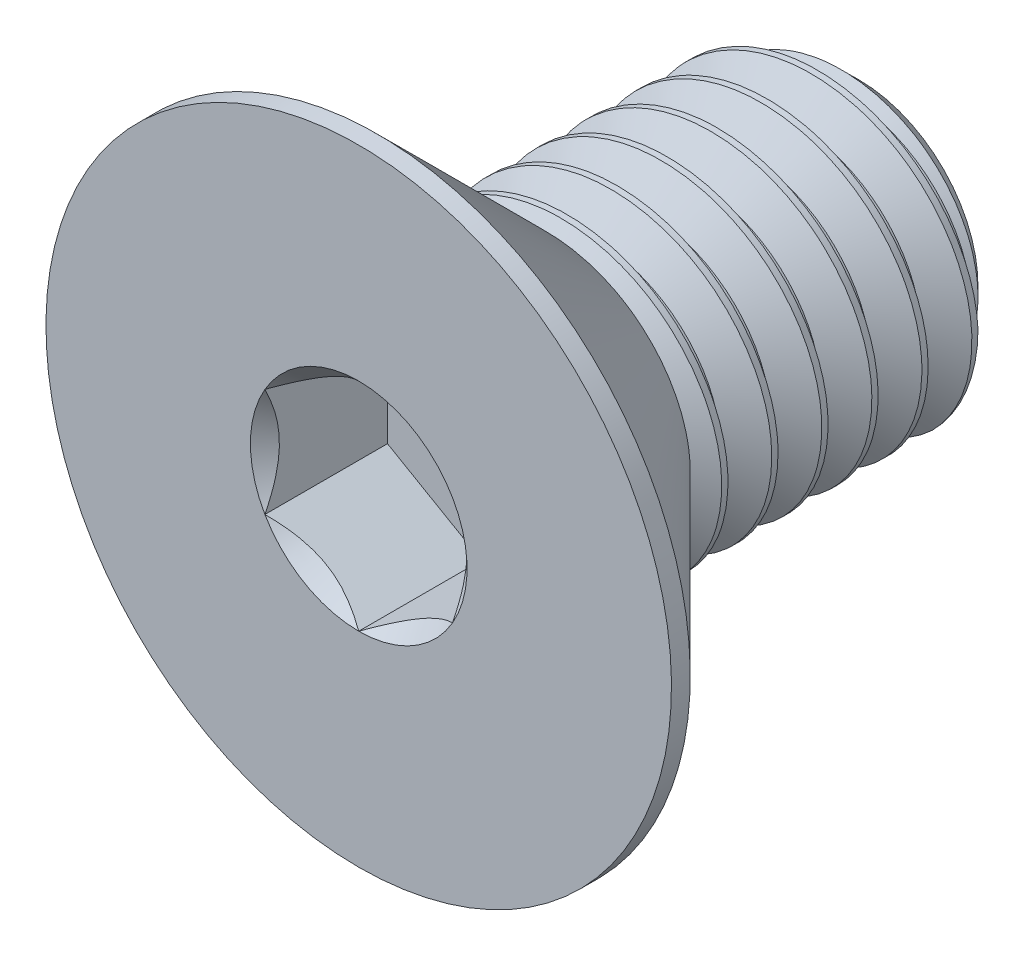
from build123d import *
from build123d.topology import SkipClean

# Parameters (mm, degrees)
SKETCH1_W          = 8
SKETCH1_H          = 2.5
CHAMFER1_SIZE      = 0.6
CUT_SWEEP1_PITCH   = 0.8
CUT_EXTRUDE2_DEPTH = 1.96


with BuildPart() as part:
    # Sketch1 → Revolve1 (revolve)
    with BuildSketch(Plane(origin=(0, 0, 0), x_dir=(0, 0, -1), z_dir=(1, 0, 0))):
        with Locations((4, 1.25)):
            Rectangle(SKETCH1_W, SKETCH1_H)
    revolve(axis=Axis((0, 0, -8), (0, 0, 1)))

    # Chamfer1
    chamfer1_edges = [part.edges().sort_by_distance(p)[0] for p in [
        (0, -2.5, -8),
    ]]
    chamfer(chamfer1_edges, length=CHAMFER1_SIZE)

    # Cut-Sweep1: the profile of Sketch2 profile screwed along a right-hand helix of 10 turns, 8 arcs to a turn; built about Z, then put on its axis
    cut_sweep1_z = Axis((0, 0, 0), (0, 0, 1))
    cut_sweep1_corners = [(2.5006, 0, 0.00034641), (2.5006, 0, -0.70034641), (1.980384758, 0, -0.4), (1.980384758, 0, -0.3)]
    with BuildLine(mode=Mode.PRIVATE) as cut_sweep1_profile:
        Line(cut_sweep1_corners[0], cut_sweep1_corners[1])
        Line(cut_sweep1_corners[1], cut_sweep1_corners[2])
        Line(cut_sweep1_corners[2], cut_sweep1_corners[3])
        Line(cut_sweep1_corners[3], cut_sweep1_corners[0])
    cut_sweep1_cap = Face(cut_sweep1_profile.wire())
    cut_sweep1_turn_angles = [0, 22.5, 45, 67.5, 90, 112.5, 135, 157.5, 180, 202.5, 225, 247.5, 270, 292.5, 315, 337.5, 360]
    cut_sweep1_turn_weights = [1, 0.9238795325112867, 1, 0.9238795325112867, 1, 0.9238795325112867, 1, 0.9238795325112867, 1, 0.9238795325112867, 1, 0.9238795325112867, 1, 0.9238795325112867, 1, 0.9238795325112867, 1]
    cut_sweep1_turn_rails = [Edge.make_bspline([Vector(p[0], p[1], 0).rotate(cut_sweep1_z, cut_sweep1_turn_angles[k]) / cut_sweep1_turn_weights[k] + Vector(0, 0, p[2] + CUT_SWEEP1_PITCH * cut_sweep1_turn_angles[k] / 360) for k in range(17)], [0, 0, 0, 1, 1, 2, 2, 3, 3, 4, 4, 5, 5, 6, 6, 7, 7, 8, 8, 8], 2, cut_sweep1_turn_weights) for p in cut_sweep1_corners]
    cut_sweep1_turn_sides = [Face.make_surface_from_curves(cut_sweep1_turn_rails[p[0]], cut_sweep1_turn_rails[p[1]]) for p in [(0, 1), (1, 2), (2, 3), (3, 0)]]
    cut_sweep1 = Plane(origin=(0, 0, -8), x_dir=(0, 1, 0), z_dir=(0, 0, 1)) * Solid(Shell([*[p.moved(Location((0, 0, CUT_SWEEP1_PITCH * i))) for i in range(10) for p in cut_sweep1_turn_sides], cut_sweep1_cap, cut_sweep1_cap.rotate(cut_sweep1_z, 3600).moved(Location((0, 0, CUT_SWEEP1_PITCH * 3600 / 360)))]))
    add(cut_sweep1, mode=Mode.SUBTRACT)

    # Sketch7 → Revolve2 (revolve)
    with BuildSketch(Plane(origin=(0, 0, 0), x_dir=(0, 0, -1), z_dir=(1, 0, 0)), mode=Mode.PRIVATE) as revolve2_sk:
        Polygon((0, 5), (0.3, 5), (2.8, 2.5), (2.8, 0), (0, 0), align=None)
    revolve(revolve2_sk.sketch.rotate(Axis((0, 0, 0), (0, 0, -1)), 180), axis=Axis((0, 0, 0), (0, 0, -1)))

    # Boss-Extrude1 cone 1 section (through the dimple's axis) → Boss-Extrude1 (revolve)
    with SkipClean():  # the faces are left unmerged after this step: merging them gives an invalid solid
        with BuildSketch(Plane(origin=(0, 0, -2.8), x_dir=(0, -1, 0), z_dir=(1, 0, 0))):
            Polygon((0, 0), (2.5, 0), (0, 2.5), align=None)
        revolve(axis=Axis((0, 0, -2.8), (0, 0, -1)))

    # Sketch5 → Cut-Extrude2 (cut)
    with SkipClean():  # the faces are left unmerged after this step: merging them gives an invalid solid
        with BuildSketch(Plane.XY):
            Polygon((1.5, -0.866025404), (1.5, 0.866025404), (0, 1.732050808), (-1.5, 0.866025404), (-1.5, -0.866025404), (0, -1.732050808), align=None)
        extrude(amount=-CUT_EXTRUDE2_DEPTH, mode=Mode.SUBTRACT)

    # Cut-Extrude3 cone 1 section (through the dimple's axis) → Cut-Extrude3 (revolve, cut)
    with SkipClean():  # the faces are left unmerged after this step: merging them gives an invalid solid
        with BuildSketch(Plane(origin=(0, 0, 0), x_dir=(0, -1, 0), z_dir=(1, 0, 0))):
            Polygon((0, 0), (1.732050808, 0), (0, 1.732050808), align=None)
        revolve(axis=Axis((0, 0, 0), (0, 0, -1)), mode=Mode.SUBTRACT)


solid = part.part
